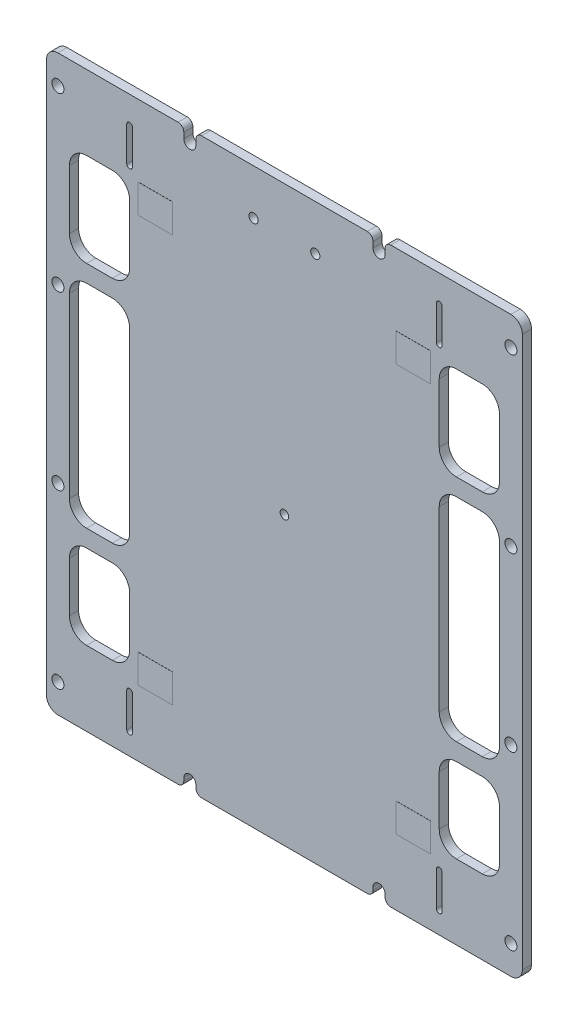
from build123d import *

# Parameters (mm, degrees)
BOARDOUTLINE_DEPTH          = 1.6
SKETCH2_R                   = 0.75
SKETCH2_R_2                 = 0.8
COMPONENTHOLES_DEPTH        = 65.998538445
SOLARCELLCONTACTHOLES_DEPTH = 1.6
WINDOWS_1SIDE_DEPTH         = 65.998538445
SKETCH5_W                   = 6
SKETCH5_H                   = 5
CONTACTPADS_DEPTH           = 0.02
M2_CLEARANCE_HOLE1_D        = 2.1
CUT_EXTRUDE1_DEPTH          = 65.999033839
FILLET3_R                   = 1
FILLET3_OF_MIRROR1_R        = 1


with BuildPart() as part:
    # Sketch1 → boardOutline (new body)
    with BuildSketch(Plane.XY):
        with BuildLine():
            Line((-39.5, -50), (39.5, -50))
            ThreePointArc((39.5, -50), (40.914213562, -49.414213562), (41.5, -48))
            Line((41.5, -48), (41.5, 48))
            ThreePointArc((41.5, 48), (40.914213562, 49.414213562), (39.5, 50))
            Line((39.5, 50), (-39.5, 50))
            ThreePointArc((-39.5, 50), (-40.914213562, 49.414213562), (-41.5, 48))
            Line((-41.5, 48), (-41.5, -48))
            ThreePointArc((-41.5, -48), (-40.914213562, -49.414213562), (-39.5, -50))
        make_face()
    extrude(amount=BOARDOUTLINE_DEPTH)

    # Sketch2 → componentHoles (cut, through all)
    with BuildSketch(Plane.XY.offset(1.6)):
        Circle(SKETCH2_R)
        with Locations((-5.385, 42.1)):
            Circle(SKETCH2_R_2)
        with Locations((5.385, 42.1)):
            Circle(SKETCH2_R_2)
    extrude(amount=-COMPONENTHOLES_DEPTH, mode=Mode.SUBTRACT)

    # Sketch4 → solarCellContactHoles (cut)
    with BuildSketch(Plane.XY.offset(1.6)):
        with BuildLine():
            Line((-27.5, 39.25), (-27.5, 45.25))
            ThreePointArc((-27.5, 45.25), (-27, 45.75), (-26.5, 45.25))
            Line((-26.5, 45.25), (-26.5, 39.25))
            ThreePointArc((-26.5, 39.25), (-27, 38.75), (-27.5, 39.25))
        make_face()
        with BuildLine():
            Line((26.5, 39.25), (26.5, 45.25))
            ThreePointArc((26.5, 45.25), (27, 45.75), (27.5, 45.25))
            Line((27.5, 45.25), (27.5, 39.25))
            ThreePointArc((27.5, 39.25), (27, 38.75), (26.5, 39.25))
        make_face()
        with BuildLine():
            Line((26.5, -46.25), (26.5, -40.25))
            ThreePointArc((26.5, -40.25), (27, -39.75), (27.5, -40.25))
            Line((27.5, -40.25), (27.5, -46.25))
            ThreePointArc((27.5, -46.25), (27, -46.75), (26.5, -46.25))
        make_face()
        with BuildLine():
            Line((-27.5, -46.25), (-27.5, -40.25))
            ThreePointArc((-27.5, -40.25), (-27, -39.75), (-26.5, -40.25))
            Line((-26.5, -40.25), (-26.5, -46.25))
            ThreePointArc((-26.5, -46.25), (-27, -46.75), (-27.5, -46.25))
        make_face()
    extrude(amount=-SOLARCELLCONTACTHOLES_DEPTH, mode=Mode.SUBTRACT)

    # Sketch3 → windows_1side (cut, through all)
    with BuildSketch(Plane.XY.offset(1.6)):
        with BuildLine():
            Line((-34.5, 37), (-30, 37))
            ThreePointArc((-30, 37), (-27.878679656, 36.121320344), (-27, 34))
            Line((-27, 34), (-27, 23.7))
            ThreePointArc((-27, 23.7), (-27.878679656, 21.578679656), (-30, 20.7))
            Line((-30, 20.7), (-34.5, 20.7))
            ThreePointArc((-34.5, 20.7), (-36.621320344, 21.578679656), (-37.5, 23.7))
            Line((-37.5, 23.7), (-37.5, 34))
            ThreePointArc((-37.5, 34), (-36.621320344, 36.121320344), (-34.5, 37))
        make_face()
        with BuildLine():
            Line((-30, -22.3), (-34.5, -22.3))
            ThreePointArc((-34.5, -22.3), (-36.621320344, -23.178679656), (-37.5, -25.3))
            Line((-37.5, -25.3), (-37.5, -34))
            ThreePointArc((-37.5, -34), (-36.621320344, -36.121320344), (-34.5, -37))
            Line((-34.5, -37), (-30, -37))
            ThreePointArc((-30, -37), (-27.878679656, -36.121320344), (-27, -34))
            Line((-27, -34), (-27, -25.3))
            ThreePointArc((-27, -25.3), (-27.878679656, -23.178679656), (-30, -22.3))
        make_face()
        with BuildLine():
            Line((-30, -19.3), (-34.5, -19.3))
            ThreePointArc((-34.5, -19.3), (-36.621320344, -18.421320344), (-37.5, -16.3))
            Line((-37.5, -16.3), (-37.5, 14.7))
            ThreePointArc((-37.5, 14.7), (-36.621320344, 16.821320344), (-34.5, 17.7))
            Line((-34.5, 17.7), (-30, 17.7))
            ThreePointArc((-30, 17.7), (-27.878679656, 16.821320344), (-27, 14.7))
            Line((-27, 14.7), (-27, -16.3))
            ThreePointArc((-27, -16.3), (-27.878679656, -18.421320344), (-30, -19.3))
        make_face()
    windows_1side = extrude(amount=-WINDOWS_1SIDE_DEPTH, mode=Mode.SUBTRACT)

    # Sketch5 → contactPads (add)
    with BuildSketch(Plane.XY.offset(1.6)):
        with Locations((-22.5, 35)):
            Rectangle(SKETCH5_W, SKETCH5_H)
        with Locations((22.5, 35)):
            Rectangle(SKETCH5_W, SKETCH5_H)
        with Locations((22.5, -36)):
            Rectangle(SKETCH5_W, SKETCH5_H)
        with Locations((-22.5, -36)):
            Rectangle(SKETCH5_W, SKETCH5_H)
    extrude(amount=CONTACTPADS_DEPTH)

    # M2 Clearance Hole1 (through all)
    with Locations(Plane(origin=(0, 0, 0), x_dir=(-1, 0, 0), z_dir=(0, 0, -1))):
        with Locations((39.5, 45), (39.5, -15), (39.5, -45), (39.5, 15)):
            m2_clearance_hole1 = Hole(M2_CLEARANCE_HOLE1_D / 2)

    # Sketch10 → Cut-Extrude1 (cut, symmetric)
    with BuildSketch(Plane(origin=(0, 0, 0), x_dir=(-1, 0, 0), z_dir=(0, 0, -1))):
        with BuildLine():
            Line((15.45, 48), (15.45, 55.073166109))
            ThreePointArc((15.45, 55.073166109), (16.5, 56.123166109), (17.55, 55.073166109))
            Line((17.55, 55.073166109), (17.55, 48))
            ThreePointArc((17.55, 48), (16.5, 46.95), (15.45, 48))
        make_face()
        with BuildLine():
            Line((17.55, -48.5), (17.55, -55.573166109))
            ThreePointArc((17.55, -55.573166109), (16.5, -56.623166109), (15.45, -55.573166109))
            Line((15.45, -55.573166109), (15.45, -48.5))
            ThreePointArc((15.45, -48.5), (16.5, -47.45), (17.55, -48.5))
        make_face()
    cut_extrude1 = extrude(amount=CUT_EXTRUDE1_DEPTH, both=True, mode=Mode.SUBTRACT)

    # Fillet3
    fillet3_edges = [part.edges().sort_by_distance(p)[0] for p in [
        (-17.55, 50, 0.8),
        (-15.45, 50, 0.8),
        (-15.45, -50, 0.8),
        (-17.55, -50, 0.8),
    ]]
    fillet(fillet3_edges, radius=FILLET3_R)

    # Mirror1: windows_1side, M2 Clearance Hole1, Cut-Extrude1 across plane
    add(windows_1side.mirror(Plane(origin=(0, 0, 0), x_dir=(0, 0, 1), z_dir=(1, 0, 0))), mode=Mode.SUBTRACT)
    add(m2_clearance_hole1.mirror(Plane(origin=(0, 0, 0), x_dir=(0, 0, 1), z_dir=(1, 0, 0))), mode=Mode.SUBTRACT)
    add(cut_extrude1.mirror(Plane(origin=(0, 0, 0), x_dir=(0, 0, 1), z_dir=(1, 0, 0))), mode=Mode.SUBTRACT)

    # Fillet3 of Mirror1
    fillet3_of_mirror1_edges = [part.edges().sort_by_distance(p)[0] for p in [
        (17.55, 50, 0.8),
        (15.45, 50, 0.8),
        (15.45, -50, 0.8),
        (17.55, -50, 0.8),
    ]]
    fillet(fillet3_of_mirror1_edges, radius=FILLET3_OF_MIRROR1_R)


solid = part.part
